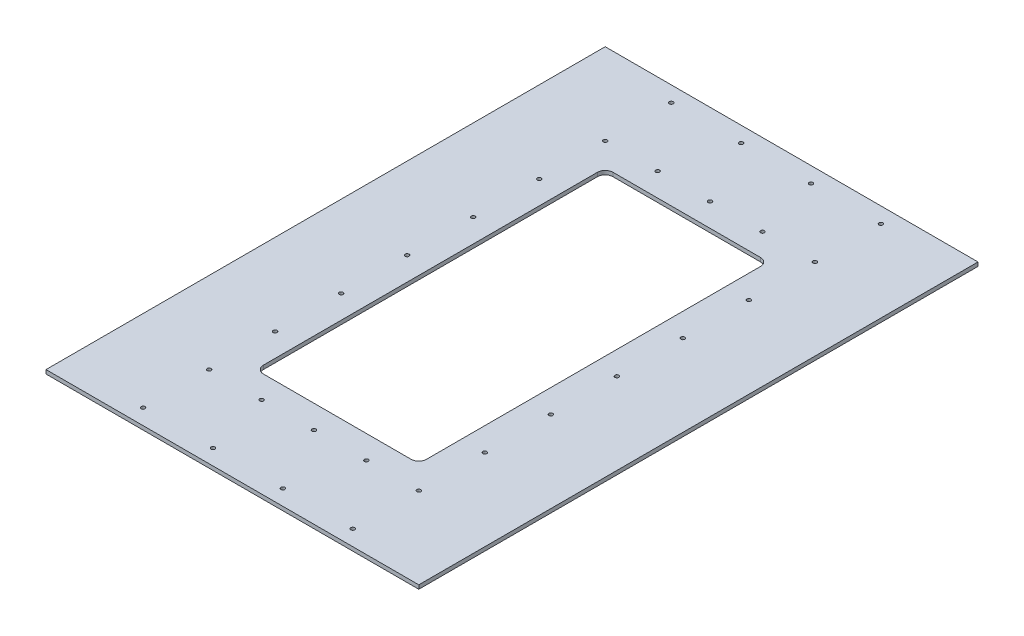
from build123d import *

# Parameters (mm, degrees)
SKETCH1_W                   = 609.6
SKETCH1_H                   = 914.4
BOSS_EXTRUDE1_DEPTH         = 6.35
SKETCH2_W                   = 266.7
SKETCH2_H                   = 571.5
CUT_EXTRUDE1_DEPTH          = 550.522704263
FILLET1_R                   = 12.7
SKETCH3_R                   = 3.175
CUT_EXTRUDE2_DEPTH          = 550.522704263
F_1_4_0_25_DIAMETER_HOLE1_D = 6.35
LPATTERN1_COUNT             = 4
LPATTERN1_PITCH             = 114.3
F_1_4_0_25_DIAMETER_HOLE2_D = 6.35
LPATTERN2_COUNT             = 4
LPATTERN2_PITCH             = 114.3


with BuildPart() as part:
    # Sketch1 → Boss-Extrude1 (new body)
    with BuildSketch(Plane(origin=(0, 609.6, 0), x_dir=(1, 0, 0), z_dir=(0, 1, 0))):
        Rectangle(SKETCH1_W, SKETCH1_H)
    extrude(amount=-BOSS_EXTRUDE1_DEPTH)

    # Sketch2 → Cut-Extrude1 (cut, through all)
    with BuildSketch(Plane(origin=(0, 609.6, 0), x_dir=(1, 0, 0), z_dir=(0, 1, 0))):
        Rectangle(SKETCH2_W, SKETCH2_H)
    extrude(amount=-CUT_EXTRUDE1_DEPTH, mode=Mode.SUBTRACT)

    # Fillet1
    fillet1_edges = [part.edges().sort_by_distance(p)[0] for p in [
        (133.35, 606.425, 285.75),
        (-133.35, 606.425, 285.75),
        (-133.35, 606.425, -285.75),
        (133.35, 606.425, -285.75),
    ]]
    fillet(fillet1_edges, radius=FILLET1_R)

    # Sketch3 → Cut-Extrude2 (cut, through all)
    with BuildSketch(Plane(origin=(0, 609.6, 0), x_dir=(1, 0, 0), z_dir=(0, 1, 0))):
        with Locations((-171.45, 215.9)):
            Circle(SKETCH3_R)
        with Locations((-171.45, 107.95)):
            Circle(SKETCH3_R)
        with Locations((-171.45, 0)):
            Circle(SKETCH3_R)
        with Locations((-171.45, -107.95)):
            Circle(SKETCH3_R)
        with Locations((-171.45, -215.9)):
            Circle(SKETCH3_R)
        with Locations((-171.45, -323.85)):
            Circle(SKETCH3_R)
        with Locations((-85.725, -323.85)):
            Circle(SKETCH3_R)
        with Locations((0, -323.85)):
            Circle(SKETCH3_R)
        with Locations((85.725, -323.85)):
            Circle(SKETCH3_R)
        with Locations((171.45, -323.85)):
            Circle(SKETCH3_R)
        with Locations((171.45, -215.9)):
            Circle(SKETCH3_R)
        with Locations((171.45, -107.95)):
            Circle(SKETCH3_R)
        with Locations((171.45, 0)):
            Circle(SKETCH3_R)
        with Locations((171.45, 107.95)):
            Circle(SKETCH3_R)
        with Locations((171.45, 215.9)):
            Circle(SKETCH3_R)
        with Locations((171.45, 323.85)):
            Circle(SKETCH3_R)
        with Locations((85.725, 323.85)):
            Circle(SKETCH3_R)
        with Locations((0, 323.85)):
            Circle(SKETCH3_R)
        with Locations((-85.725, 323.85)):
            Circle(SKETCH3_R)
        with Locations((-171.45, 323.85)):
            Circle(SKETCH3_R)
    extrude(amount=-CUT_EXTRUDE2_DEPTH, mode=Mode.SUBTRACT)

    # 1/4 (0.25) Diameter Hole1 (through all)
    with Locations(Plane(origin=(0, 609.6, 0), x_dir=(1, 0, 0), z_dir=(0, 1, 0))):
        with Locations((171.45, -431.8)):
            f_1_4_0_25_diameter_hole1 = Hole(F_1_4_0_25_DIAMETER_HOLE1_D / 2)

    # LPattern1: 1/4 (0.25) Diameter Hole1 ×4
    with Locations(*[(-i * LPATTERN1_PITCH, 0, 0) for i in range(1, LPATTERN1_COUNT)]):
        add(f_1_4_0_25_diameter_hole1, mode=Mode.SUBTRACT)

    # 1/4 (0.25) Diameter Hole2 (through all)
    with Locations(Plane(origin=(0, 609.6, 0), x_dir=(1, 0, 0), z_dir=(0, 1, 0))):
        with Locations((-171.45, 431.8)):
            f_1_4_0_25_diameter_hole2 = Hole(F_1_4_0_25_DIAMETER_HOLE2_D / 2)

    # LPattern2: 1/4 (0.25) Diameter Hole2 ×4
    with Locations(*[(i * LPATTERN2_PITCH, 0, 0) for i in range(1, LPATTERN2_COUNT)]):
        add(f_1_4_0_25_diameter_hole2, mode=Mode.SUBTRACT)


solid = part.part
